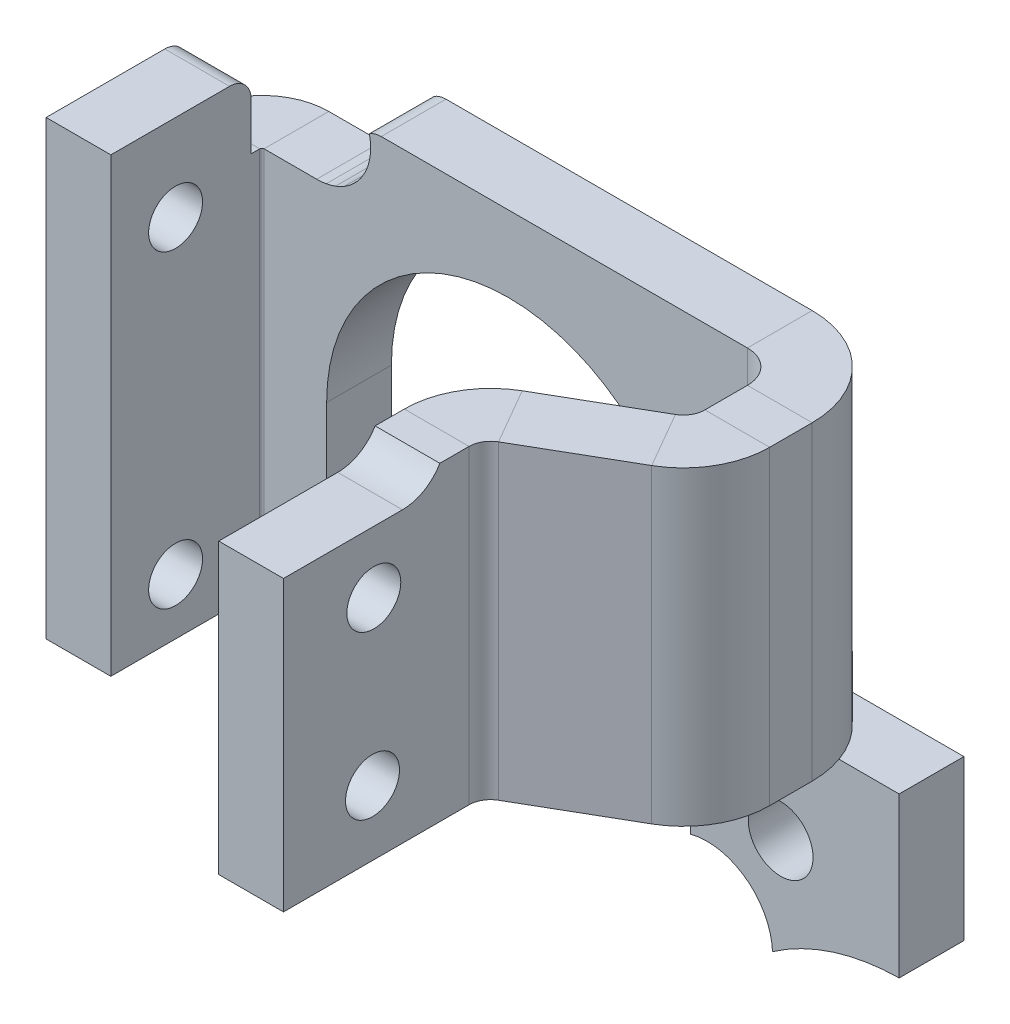
from build123d import *

# Parameters (mm, degrees)
SKETCH1_W                    = 30.529513274
SKETCH1_H                    = 24
BOSS_EXTRUDE1_DEPTH          = 3
SKETCH2_R                    = 1.5
CUT_EXTRUDE1_DEPTH           = 10
SKETCH6_R                    = 3.031001388
SKETCH6_R_2                  = 1.013144299
CUT_EXTRUDE3_DEPTH           = 10
SKETCH4_W                    = 2
SKETCH4_H                    = 19.928154349
BOSS_EXTRUDE2_DEPTH          = 10
SKETCH5_R                    = 1.25
CUT_EXTRUDE2_DEPTH           = 36.369951754
SKETCH31_W                   = 7.266440603
SKETCH31_H                   = 7.840373691
CUT_EXTRUDE6_DEPTH           = 10
CONVERT_SOLID1_START         = -13.578124278
CONVERT_SOLID1_OUTLINE_W     = 19.928154349
CONVERT_SOLID1_OUTLINE_H     = 7
CONVERT_SOLID1_OUTLINE_R     = 1.25
CONVERT_SOLID1_DEPTH         = 0.707422
CONVERT_SOLID1_START_2       = -13.870702278
CONVERT_SOLID1_2_OUTLINE_W   = 19.928154349
CONVERT_SOLID1_2_OUTLINE_H   = 10
CONVERT_SOLID1_2_OUTLINE_R   = 1.25
CONVERT_SOLID1_2_DEPTH       = 1
CONVERT_SOLID1_START_3       = -12.304269382
CONVERT_SOLID1_3_OUTLINE_W   = 19.928154349
CONVERT_SOLID1_3_OUTLINE_H   = 7
CONVERT_SOLID1_3_OUTLINE_R   = 1.25
CONVERT_SOLID1_3_DEPTH       = 1.533567104
CONVERT_SOLID1_START_4       = -7.401252108
CONVERT_SOLID1_4_DEPTH       = 19.928154349
SKETCH24_W                   = 5.529513274
SKETCH24_H                   = 14.38372484
CUT_EXTRUDE4_DEPTH           = 10
EDGE_FLANGE4_STRIP_W         = 15
EDGE_FLANGE4_STRIP_H         = 3
EDGE_FLANGE4_STRIP_CUT_DEPTH = 14.38372484
EDGE_FLANGE4_DEPTH           = 14.38372484
JOG1_START                   = -1.856822599
JOG1_DEPTH                   = 14.38372484
JOG1_2_DEPTH                 = 14.38372484
SKETCH30_R                   = 1.25
CUT_EXTRUDE5_DEPTH           = 10
SKETCH32_R                   = 1.013144299
BOSS_EXTRUDE3_DEPTH          = 3
SKETCH33_W                   = 7.665012493
SKETCH33_H                   = 1
CUT_EXTRUDE7_DEPTH           = 10
FILLET1_R                    = 2
SKETCH34_W                   = 3
SKETCH34_H                   = 5.209304408
BOSS_EXTRUDE4_DEPTH          = 1
FILLET2_START                = -13.870702278
FILLET2_DEPTH                = 3
CUT_EXTRUDE8_START           = -3.5
CUT_EXTRUDE8_DEPTH           = 3.5
FILLET3_R                    = 1


with BuildPart() as part:
    # Sketch1 → Boss-Extrude1 (new body)
    with BuildSketch(Plane.XY):
        with Locations((3.394054359, 0.526902241)):
            Rectangle(SKETCH1_W, SKETCH1_H)
    extrude(amount=BOSS_EXTRUDE1_DEPTH)

    # Sketch2 → Cut-Extrude1 (cut)
    with BuildSketch(Plane.XY.offset(3)):
        with Locations((13.168159701, -6.404941255)):
            Circle(SKETCH2_R)
        with BuildLine():
            Line((8.976475461, 0.589001072), (9.005600067, -15.908139628))
            ThreePointArc((9.005600067, -15.908139628), (29.280658421, -19.723388497), (9.019197546, -23.610201897))
            Line((9.019197546, -23.610201897), (9.019729255, -23.911379441))
            ThreePointArc((9.019729255, -23.911379441), (0.556548127, -32.385304577), (-7.913797188, -23.918540598))
            Line((-7.913797188, -23.918540598), (-7.870540366, 0.589001072))
            ThreePointArc((-7.870540366, 0.589001072), (0.552967548, 9.012508985), (8.976475461, 0.589001072))
        make_face()
    extrude(amount=-CUT_EXTRUDE1_DEPTH, mode=Mode.SUBTRACT)

    # Sketch6 → Cut-Extrude3 (cut)
    with BuildSketch(Plane.XY.offset(3)):
        with Locations((9.76051578, -11.237842953)):
            Circle(SKETCH6_R)
        with Locations((-9.621874041, -9.528153609)):
            Circle(SKETCH6_R_2)
    extrude(amount=-CUT_EXTRUDE3_DEPTH, mode=Mode.SUBTRACT)

    # Sketch4 → Boss-Extrude2 (add)
    with BuildSketch(Plane.XY):
        with Locations((-11.870702278, 2.562825066)):
            Rectangle(SKETCH4_W, SKETCH4_H)
    extrude(amount=BOSS_EXTRUDE2_DEPTH)

    # Sketch5 → Cut-Extrude2 (cut, through all)
    with BuildSketch(Plane(origin=(-12.870702278, 0, 0), x_dir=(0, 0, -1), z_dir=(1, 0, 0))):
        with Locations(Location((-7, 8.522127831, 0), (0, 0, 180))):
            Circle(SKETCH5_R)
        with Locations(Location((-7, -5.809148927, 0), (0, 0, 180))):
            Circle(SKETCH5_R)
    extrude(amount=CUT_EXTRUDE2_DEPTH, mode=Mode.SUBTRACT)

    # Sketch31 → Cut-Extrude6 (cut)
    with BuildSketch(Plane.XY.offset(3)):
        with Locations((-8.237481976, -11.321438954)):
            Rectangle(SKETCH31_W, SKETCH31_H)
    extrude(amount=-CUT_EXTRUDE6_DEPTH, mode=Mode.SUBTRACT)

    # Convert-Solid1: read off the stored shape, not the designer's step
    # Convert-Solid1 outline → Convert-Solid1 (add)
    with BuildSketch(Plane.YZ.offset(CONVERT_SOLID1_START)):
        with Locations((2.562825066, 6.5)):
            Rectangle(CONVERT_SOLID1_OUTLINE_W, CONVERT_SOLID1_OUTLINE_H)
        with Locations((-5.809148927, 7)):
            Circle(CONVERT_SOLID1_OUTLINE_R, mode=Mode.SUBTRACT)
        with Locations((8.522127831, 7)):
            Circle(CONVERT_SOLID1_OUTLINE_R, mode=Mode.SUBTRACT)
    extrude(amount=CONVERT_SOLID1_DEPTH)

    # Convert-Solid1 2 outline → Convert-Solid1 2 (add)
    with BuildSketch(Plane.YZ.offset(CONVERT_SOLID1_START_2)):
        with Locations((2.562825066, 5)):
            Rectangle(CONVERT_SOLID1_2_OUTLINE_W, CONVERT_SOLID1_2_OUTLINE_H)
        with Locations((8.522127831, 7)):
            Circle(CONVERT_SOLID1_2_OUTLINE_R, mode=Mode.SUBTRACT)
        with Locations((-5.809148927, 7)):
            Circle(CONVERT_SOLID1_2_OUTLINE_R, mode=Mode.SUBTRACT)
    extrude(amount=CONVERT_SOLID1_2_DEPTH)

    # Convert-Solid1 3 outline → Convert-Solid1 3 (add)
    with BuildSketch(Plane.YZ.offset(CONVERT_SOLID1_START_3)):
        with Locations((2.562825066, 6.5)):
            Rectangle(CONVERT_SOLID1_3_OUTLINE_W, CONVERT_SOLID1_3_OUTLINE_H)
        with Locations((-5.809148927, 7)):
            Circle(CONVERT_SOLID1_3_OUTLINE_R, mode=Mode.SUBTRACT)
        with Locations((8.522127831, 7)):
            Circle(CONVERT_SOLID1_3_OUTLINE_R, mode=Mode.SUBTRACT)
    extrude(amount=CONVERT_SOLID1_3_DEPTH)

    # Convert-Solid1 4 outline → Convert-Solid1 4 (cut)
    with BuildSketch(Plane(origin=(0, 0, 0), x_dir=(1, 0, 0), z_dir=(0, 1, 0)).offset(CONVERT_SOLID1_START_4)):
        with BuildLine():
            ThreePointArc((-10.770702278, -3), (-10.841412956, -3.029289322), (-10.870702278, -3.1))
            Line((-10.870702278, -3.1), (-10.870702278, -10))
            Line((-10.870702278, -10), (-10.770702278, -10))
            Line((-10.770702278, -10), (-10.770702278, -3))
        make_face()
        with BuildLine():
            Line((-13.870702278, 0), (-13.870702278, -3.1))
            ThreePointArc((-13.870702278, -3.1), (-12.9627333, -0.907968978), (-10.770702278, 0))
            Line((-10.770702278, 0), (-13.870702278, 0))
        make_face()
    extrude(amount=CONVERT_SOLID1_4_DEPTH, mode=Mode.SUBTRACT)

    # Sketch24 → Cut-Extrude4 (cut)
    with BuildSketch(Plane.XY.offset(3)):
        with Locations((15.894054359, 5.335039821)):
            Rectangle(SKETCH24_W, SKETCH24_H)
    extrude(amount=-CUT_EXTRUDE4_DEPTH, mode=Mode.SUBTRACT)

    # Edge-Flange4: sheet metal written as solids
    # Edge-Flange4 strip (on a plane across the edge) → Edge-Flange4 strip cut (cut)
    with BuildSketch(Plane(origin=(13.129297722, -1.856822599, 3), x_dir=(-1, 0, 0), z_dir=(0, 1, 0))):
        with Locations((-6, -1.5)):
            Rectangle(EDGE_FLANGE4_STRIP_W, EDGE_FLANGE4_STRIP_H)
    extrude(amount=EDGE_FLANGE4_STRIP_CUT_DEPTH, mode=Mode.SUBTRACT)

    # Edge-Flange4 section (on a plane across the edge) → Edge-Flange4 (add)
    with BuildSketch(Plane(origin=(13.129297722, -1.856822599, 3), x_dir=(-1, 0, 0), z_dir=(0, 1, 0))):
        with BuildLine():
            Line((-3, 1.5), (-3, 19))
            Line((-3, 19), (0, 19))
            Line((0, 19), (0, 1.5))
            ThreePointArc((0, 1.5), (0.439339828, 0.439339828), (1.5, 0))
            Line((1.5, 0), (1.5, -3))
            ThreePointArc((1.5, -3), (-1.681980515, -1.681980515), (-3, 1.5))
        make_face()
    extrude(amount=EDGE_FLANGE4_DEPTH)

    # Jog1: read off the stored shape, not the designer's step
    # Jog1 outline → Jog1 (cut)
    with BuildSketch(Plane(origin=(0, 0, 0), x_dir=(1, 0, 0), z_dir=(0, 1, 0)).offset(JOG1_START)):
        with BuildLine():
            Line((14.129297722, -9.936789869), (13.129297722, -10.514140138))
            Line((13.129297722, -10.514140138), (13.129297722, -22))
            Line((13.129297722, -22), (16.129297722, -22))
            Line((16.129297722, -22), (16.129297722, -6.472688254))
            ThreePointArc((16.129297722, -6.472688254), (15.593399337, -8.472688254), (14.129297722, -9.936789869))
        make_face()
    extrude(amount=JOG1_DEPTH, mode=Mode.SUBTRACT)

    # Jog1 2 outline → Jog1 2 (add)
    with BuildSketch(Plane(origin=(0, 0, 0), x_dir=(1, 0, 0), z_dir=(0, 1, 0)).offset(JOG1_START)):
        with BuildLine():
            ThreePointArc((13.129297722, -6.472688254), (12.995323126, -6.972688254), (12.629297722, -7.338713658))
            Line((12.629297722, -7.338713658), (8.129297722, -9.936789869))
            ThreePointArc((8.129297722, -9.936789869), (6.665196107, -11.400891484), (6.129297722, -13.400891484))
            Line((6.129297722, -13.400891484), (6.129297722, -22))
            Line((6.129297722, -22), (9.129297722, -22))
            Line((9.129297722, -22), (9.129297722, -13.400891484))
            ThreePointArc((9.129297722, -13.400891484), (9.263272318, -12.900891484), (9.629297722, -12.534866081))
            Line((9.629297722, -12.534866081), (13.129297722, -10.514140138))
            Line((13.129297722, -10.514140138), (13.129297722, -6.472688254))
        make_face()
    extrude(amount=JOG1_2_DEPTH)

    # Sketch30 → Cut-Extrude5 (cut)
    with BuildSketch(Plane(origin=(9.129297722, 0, 0), x_dir=(0, 0, -1), z_dir=(1, 0, 0))):
        with Locations((-17.875225206, 1.154804866)):
            Circle(SKETCH30_R)
        with Locations((-17.814240258, 8.660520186)):
            Circle(SKETCH30_R)
    extrude(amount=-CUT_EXTRUDE5_DEPTH, mode=Mode.SUBTRACT)

    # Sketch32 → Boss-Extrude3 (add)
    with BuildSketch(Plane.XY.offset(3)):
        Polygon((-7.884643492, -7.401252108), (-10.770702278, -7.401252108), (-10.770702278, -7.827453032), (-11.321822858, -7.827453032), (-11.321822858, -11.473097759), (-10.770702278, -11.473097759), (-7.884643492, -11.473097759), align=None)
        with Locations((-9.621874041, -9.528153609)):
            Circle(SKETCH32_R, mode=Mode.SUBTRACT)
    extrude(amount=-BOSS_EXTRUDE3_DEPTH)

    # Sketch33 → Cut-Extrude7 (cut)
    with BuildSketch(Plane(origin=(9.129297722, 0, 0), x_dir=(0, 0, -1), z_dir=(1, 0, 0))):
        with Locations((-18.587893568, 12.026902241)):
            Rectangle(SKETCH33_W, SKETCH33_H)
    extrude(amount=-CUT_EXTRUDE7_DEPTH, mode=Mode.SUBTRACT)

    # Fillet1
    # the kernel refuses this fillet: 2 mm, written as the material it adds along each edge
    with BuildSketch(Plane(origin=(9.129297722, 11.526902241, 14.755387321), x_dir=(0, 1, 0), z_dir=(-1, 0, 0))) as fillet1_piece_1:
        with BuildLine():
            CenterArc((2, -1.732050808), FILLET1_R, 120, 60)
            Line((0, -1.732050808), (-0.04, -1.732050808))
            Line((-0.04, -1.732050808), (-0.04, 0))
            Line((-0.04, 0), (0, 0.04))
            ThreePointArc((0, 0.04), (0.5, 0.04), (0.98, 0.034641016))
            Line((0.98, 0.034641016), (1, 0))
        make_face()
    extrude(amount=3)

    # Sketch34 → Boss-Extrude4 (add)
    with BuildSketch(Plane(origin=(0, -7.401252108, 0), x_dir=(-1, 0, 0), z_dir=(0, -1, 0))):
        with Locations((12.370702278, -7.395347796)):
            Rectangle(SKETCH34_W, SKETCH34_H)
    extrude(amount=BOSS_EXTRUDE4_DEPTH)

    # Fillet2: read off the stored shape, not the designer's step
    # Fillet2 outline → Fillet2 (add)
    with BuildSketch(Plane.YZ.offset(FILLET2_START)):
        with BuildLine():
            ThreePointArc((-8.401252108, 4.790695592), (-7.669201301, 4.058644784), (-7.401252108, 3.058644784))
            Line((-7.401252108, 3.058644784), (-7.401252108, 4.790695592))
            Line((-7.401252108, 4.790695592), (-8.401252108, 4.790695592))
        make_face()
    extrude(amount=FILLET2_DEPTH)

    # Cut-Extrude8: read off the stored shape, not the designer's step
    # Cut-Extrude8 outline → Cut-Extrude8 (cut)
    with BuildSketch(Plane(origin=(0, 0, 0), x_dir=(-1, 0, 0), z_dir=(0, 0, -1)).offset(CUT_EXTRUDE8_START)):
        with BuildLine():
            add(Edge.make_bspline(
                [(5.934293569, 12.526902242), (5.918772793, 12.474323244), (5.904747253, 12.419100587), (5.892251154, 12.361173794)],
                knots=[0.637263122, 0.637263122, 0.637263122, 0.637263122, 0.651841432, 0.651841432, 0.651841432, 0.651841432], degree=3))
            ThreePointArc((5.892251154, 12.361173794), (5.853557529, 12.140940274), (5.834697256, 11.918130287))
            add(Edge.make_bspline(
                [(5.834697256, 11.918130287), (5.828106476, 11.7671908), (5.836044906, 11.619075327), (5.856920418, 11.471917187)],
                knots=[0.686657289, 0.686657289, 0.686657289, 0.686657289, 0.721473146, 0.721473146, 0.721473146, 0.721473146], degree=3))
            ThreePointArc((5.856920418, 11.471917187), (5.897826068, 11.252083778), (5.958210921, 11.036784754))
            add(Edge.make_bspline(
                [(5.958210921, 11.036784754), (6.004813319, 10.89501127), (6.064205524, 10.757665111), (6.135333951, 10.626629378)],
                knots=[0.756289002, 0.756289002, 0.756289002, 0.756289002, 0.791104859, 0.791104859, 0.791104859, 0.791104859], degree=3))
            ThreePointArc((6.135333951, 10.626629378), (6.382632907, 10.254549782), (6.69221005, 9.9324287))
            add(Edge.make_bspline(
                [(6.69221005, 9.9324287), (6.804734203, 9.834537986), (6.9260354, 9.746668372), (7.054178725, 9.670553388)],
                knots=[0.860736573, 0.860736573, 0.860736573, 0.860736573, 0.89555243, 0.89555243, 0.89555243, 0.89555243], degree=3))
            ThreePointArc((7.054178725, 9.670553388), (7.251253019, 9.564904332), (7.4569791, 9.477287098))
            add(Edge.make_bspline(
                [(7.4569791, 9.477287098), (7.596650694, 9.424496148), (7.741008428, 9.383274602), (7.887747341, 9.358801983)],
                knots=[0.930368286, 0.930368286, 0.930368286, 0.930368286, 0.965184143, 0.965184143, 0.965184143, 0.965184143], degree=3))
            ThreePointArc((7.887747341, 9.358801983), (8.109343355, 9.328881983), (8.332726434, 9.318881983))
            Line((8.332726434, 9.318881983), (13.870702278, 9.318881983))
            Line((13.870702278, 9.318881983), (13.870702278, 12.526902241))
            Line((13.870702278, 12.526902241), (5.934293569, 12.526902242))
        make_face()
    extrude(amount=CUT_EXTRUDE8_DEPTH, mode=Mode.SUBTRACT)

    # Fillet3
    # the kernel refuses this fillet: 1 mm, written as the material it takes off along each edge
    with BuildSketch(Plane(origin=(-5.934293569, 12.526902242, 4.483490455), x_dir=(1.0, -1.2849512844453004e-09, 0), z_dir=(0, 0, -1))) as fillet3_piece_1:
        with BuildLine():
            CenterArc((0.593396183, 1), FILLET3_R, 236.540063236, 33.45993669)
            Line((0.042042415, 0.165728448), (0.03101534, 0.149043017))
            ThreePointArc((0.03101534, 0.149043017), (0.003175491, 0.087378927), (-0.019181734, 0.00566225))
            Line((-0.019181734, 0.00566225), (0, -0.02))
            Line((0, -0.02), (0.593396182, -0.02))
            Line((0.593396182, -0.02), (0.593396182, 0))
        make_face()
    extrude(amount=5.966980909, mode=Mode.SUBTRACT)
    with BuildSketch(Plane(origin=(-16.370702278, 12.526902241, 3.5), x_dir=(1.2600158578102924e-10, -1.0, 0), z_dir=(1.0, 1.2600158578102924e-10, 0))) as fillet3_piece_2:
        with BuildLine():
            CenterArc((FILLET3_R, -FILLET3_R), FILLET3_R, 90, 90)
            Line((0, -FILLET3_R), (-FILLET3_R * 0.0200000000485, -FILLET3_R))
            Line((-FILLET3_R * 0.0200000000485, -FILLET3_R), (-FILLET3_R * 0.02, FILLET3_R * 0.02))
            Line((-FILLET3_R * 0.02, FILLET3_R * 0.02), (FILLET3_R, FILLET3_R * 0.02))
            Line((FILLET3_R, FILLET3_R * 0.02), (FILLET3_R, 0))
        make_face()
    extrude(amount=8, mode=Mode.SUBTRACT)


solid = part.part
